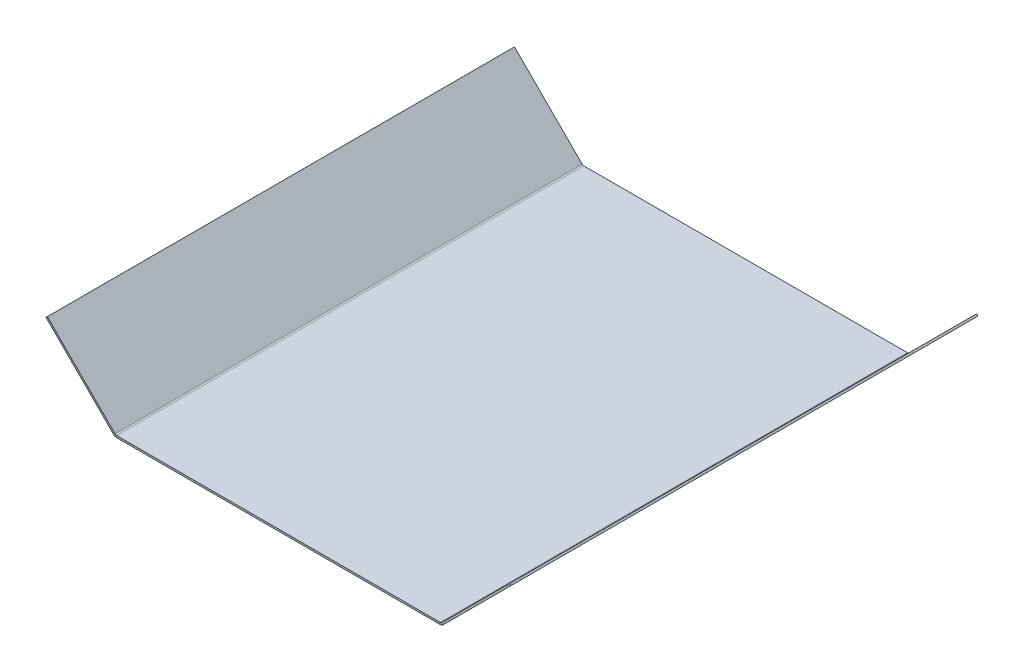
from build123d import *

# Parameters (mm, degrees)
T_LE_DE_BASE_PLI_E1_DEPTH = 200


# Sheet-metal steps are written as plain solids
with BuildPart() as part:
    # Esquisse1 → Tôle de base pliée1 (new body)
    with BuildSketch(Plane.XY):
        with BuildLine():
            Line((-99.5, 29.5), (-70.527207794, 0.527207794))
            ThreePointArc((-70.527207794, 0.527207794), (-69.943245766, 0.137016841), (-69.254415588, 0))
            Line((-69.254415588, 0), (69.254415588, 0))
            ThreePointArc((69.254415588, 0), (69.943245766, 0.137016841), (70.527207794, 0.527207794))
            Line((70.527207794, 0.527207794), (99.5, 29.5))
            Line((99.5, 29.5), (98.934314575, 30.065685425))
            Line((98.934314575, 30.065685425), (69.961522369, 1.092893219))
            ThreePointArc((69.961522369, 1.092893219), (69.63709902, 0.876120467), (69.254415588, 0.8))
            Line((69.254415588, 0.8), (-69.254415588, 0.8))
            ThreePointArc((-69.254415588, 0.8), (-69.63709902, 0.876120467), (-69.961522369, 1.092893219))
            Line((-69.961522369, 1.092893219), (-98.934314575, 30.065685425))
            Line((-98.934314575, 30.065685425), (-99.5, 29.5))
        make_face()
    extrude(amount=T_LE_DE_BASE_PLI_E1_DEPTH)


solid = part.part
